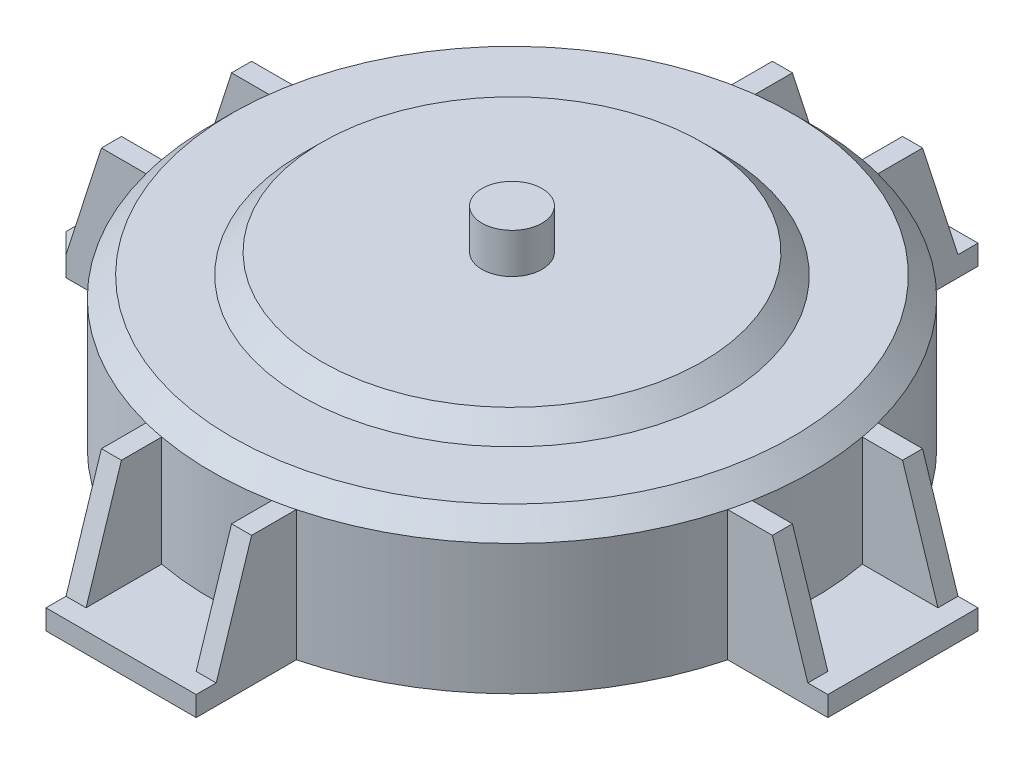
from build123d import *

# Parameters (mm, degrees)
SKETCH1_R                = 150
BOSS_EXTRUDE1_DEPTH      = 75
CHAMFER1_SIZE            = 10
BOSS_EXTRUDE2_DEPTH      = 10
CHAMFER2_SIZE            = 10
BOSS_EXTRUDE3_DEPTH      = 10
CIRPATTERN1_COUNT        = 4
CIRPATTERN1_COPY_1_DEPTH = 10
CIRPATTERN1_COPY_2_DEPTH = 10
CIRPATTERN1_COPY_3_DEPTH = 10
SKETCH8_R                = 110
BOSS_EXTRUDE5_DEPTH      = 10
CHAMFER3_SIZE            = 15
SKETCH9_R                = 15
BOSS_EXTRUDE6_DEPTH      = 20
SCALE1_SCALE             = 0.45
SKETCH10_W               = 3.419230769
SKETCH10_H               = 19.05
CUT_EXTRUDE1_DEPTH       = 2


with BuildPart() as part:
    # Sketch1 → Boss-Extrude1 (new body)
    with BuildSketch(Plane(origin=(0, 0, 0), x_dir=(1, 0, 0), z_dir=(0, 1, 0))):
        with Locations(Location((0, 0, 0), (0, 0, 270))):
            Circle(SKETCH1_R)
    extrude(amount=BOSS_EXTRUDE1_DEPTH)

    # Chamfer1
    chamfer1_edges = [part.edges().sort_by_distance(p)[0] for p in [
        (0, 75, -150),
    ]]
    chamfer(chamfer1_edges, length=CHAMFER1_SIZE)

    # Sketch4 → Boss-Extrude2 (add)
    with BuildSketch(Plane.XZ):
        with BuildLine():
            Line((-145.236875483, 37.5), (-195.236875483, 37.5))
            Line((-195.236875483, 37.5), (-195.236875483, -37.5))
            Line((-195.236875483, -37.5), (-145.236875483, -37.5))
            ThreePointArc((-145.236875483, -37.5), (-150, 0), (-145.236875483, 37.5))
        make_face()
    boss_extrude2 = extrude(amount=-BOSS_EXTRUDE2_DEPTH)

    # Chamfer2
    chamfer2_edges = [part.edges().sort_by_distance(p)[0] for p in [
        (-195.236875483, 5, -37.5),
        (-195.236875483, 5, 37.5),
    ]]
    chamfer(chamfer2_edges, length=CHAMFER2_SIZE)

    # Sketch5 → Boss-Extrude3 (add)
    with BuildSketch(Plane.XY.offset(37.5)):
        Polygon((-145.236875483, 10), (-145.236875483, 65), (-167.556875483, 65), (-185.236875483, 10), align=None)
    boss_extrude3 = extrude(amount=-BOSS_EXTRUDE3_DEPTH)

    # Mirror1: Boss-Extrude3 across plane
    add(boss_extrude3.mirror(Plane.XY))

    # CirPattern1: Boss-Extrude2, Boss-Extrude3 ×4 about axis
    cirpattern1_axis = Axis((0, 0, 0), (0, 1, 0))
    add([boss_extrude2.rotate(cirpattern1_axis, i * 360 / CIRPATTERN1_COUNT) for i in range(1, CIRPATTERN1_COUNT)])
    add([boss_extrude3.rotate(cirpattern1_axis, i * 360 / CIRPATTERN1_COUNT) for i in range(1, CIRPATTERN1_COUNT)])

    # CirPattern1 copy 1 sketch → CirPattern1 copy 1 (add)
    with BuildSketch(Plane(origin=(-37.5, 0, 0), x_dir=(0, 0, -1), z_dir=(-1, 0, 0))):
        Polygon((-145.236875483, -10), (-145.236875483, -65), (-167.556875483, -65), (-185.236875483, -10), align=None)
    extrude(amount=-CIRPATTERN1_COPY_1_DEPTH)

    # CirPattern1 copy 2 sketch → CirPattern1 copy 2 (add)
    with BuildSketch(Plane(origin=(0, 0, 37.5), x_dir=(-1, 0, 0), z_dir=(0, 0, 1))):
        Polygon((-145.236875483, -10), (-145.236875483, -65), (-167.556875483, -65), (-185.236875483, -10), align=None)
    extrude(amount=-CIRPATTERN1_COPY_2_DEPTH)

    # CirPattern1 copy 3 sketch → CirPattern1 copy 3 (add)
    with BuildSketch(Plane(origin=(37.5, 0, 0), x_dir=(0, 0, 1), z_dir=(1, 0, 0))):
        Polygon((-145.236875483, -10), (-145.236875483, -65), (-167.556875483, -65), (-185.236875483, -10), align=None)
    extrude(amount=-CIRPATTERN1_COPY_3_DEPTH)

    # Sketch8 → Boss-Extrude5 (add)
    with BuildSketch(Plane(origin=(0, 75, 0), x_dir=(1, 0, 0), z_dir=(0, 1, 0))):
        with Locations(Location((0, 0, 0), (0, 0, 270))):
            Circle(SKETCH8_R)
    extrude(amount=BOSS_EXTRUDE5_DEPTH)

    # Chamfer3
    # the kernel refuses this chamfer: 15 mm, written as the material it takes off along each edge
    with BuildSketch(Plane(origin=(0, 85, 0), x_dir=(0, 0, 1), z_dir=(-1, 0, 0))) as chamfer3_piece_1_section:
        Polygon((110, -CHAMFER3_SIZE), (110 - CHAMFER3_SIZE, 0), (110, 0), align=None)
    chamfer3_piece_1 = revolve(axis=Axis((0, 85, 0), (0, 1, 0)), mode=Mode.PRIVATE)
    chamfer3_piece_1 = split(chamfer3_piece_1, bisect_by=Plane(origin=(0, 75, -100.081022807), z_dir=(0, 1, 0)), keep=Keep.TOP, mode=Mode.PRIVATE)
    add(chamfer3_piece_1, mode=Mode.SUBTRACT)

    # Sketch9 → Boss-Extrude6 (add)
    with BuildSketch(Plane(origin=(0, 85, 0), x_dir=(1, 0, 0), z_dir=(0, 1, 0))):
        with Locations(Location((0, 0, 0), (0, 0, 270))):
            Circle(SKETCH9_R)
    extrude(amount=BOSS_EXTRUDE6_DEPTH)


with BuildPart() as part_1:
    # Scale1: scaled about (0.032774232, 38.808479164, 0)
    add(part.part.scale(SCALE1_SCALE).moved(Location((0.018025828, 21.34466354, 0))))

    # Sketch10 → Cut-Extrude1 (cut)
    with BuildSketch(Plane(origin=(0, 21.34466354, 0), x_dir=(-1, 0, 0), z_dir=(0, -1, 0))):
        with Locations((-15.883109565, 0.516821173)):
            Rectangle(SKETCH10_W, SKETCH10_H)
        with Locations((-8.556186488, 0.516821173)):
            Rectangle(SKETCH10_W, SKETCH10_H)
        Polygon((-4.404263412, 10.041821173), (5.853428896, 10.041821173), (5.853428896, 6.622590404), (2.434198127, 6.622590404), (2.434198127, -9.008178827), (-0.985032643, -9.008178827), (-0.985032643, 6.622590404), (-4.404263412, 6.622590404), align=None)
        with BuildLine():
            Line((25.998651252, 7.011833193), (23.41133154, 4.535180548))
            add(Edge.make_bspline(
                [(23.41133154, 4.535180548), (23.206488924, 4.740268602), (22.804553892, 5.142685223), (22.147239428, 5.66645811), (21.466461133, 6.111768609), (20.759978292, 6.47793405), (20.02680677, 6.761963802), (19.268393428, 6.965139371), (18.483504426, 7.085646244), (17.952169606, 7.102516796), (17.68335678, 7.111051943)],
                knots=[0, 0, 0, 0, 1.075575784, 2.110457258, 3.113929901, 4.09197124, 5.059417775, 6.02750972, 7.002078037, 8, 8, 8, 8], degree=3))
            add(Edge.make_bspline(
                [(17.68335678, 7.111051943), (17.450304279, 7.105071404), (16.992685263, 7.093328092), (16.320258194, 7.004150183), (15.677712938, 6.855182498), (15.062013849, 6.648812643), (14.47691998, 6.380260237), (13.919041191, 6.053670071), (13.391810672, 5.666543703), (12.899379983, 5.226219704), (12.451020256, 4.745474799), (12.059578539, 4.230907755), (11.726154292, 3.692109668), (11.451678135, 3.126323966), (11.242831628, 2.534419018), (11.093742551, 1.916824516), (10.999108061, 1.275335276), (10.987934554, 0.837704673), (10.98227505, 0.616039923)],
                knots=[0, 0, 0, 0, 1.075001177, 2.110859044, 3.123021556, 4.114053297, 5.101481495, 6.087880186, 7.091499647, 8.114004866, 9.131394192, 10.11971144, 11.092043119, 12.050101265, 13.015322563, 13.981809771, 14.977764287, 16, 16, 16, 16], degree=3))
            add(Edge.make_bspline(
                [(10.98227505, 0.616039923), (10.987553965, 0.386703059), (10.997954151, -0.065121959), (11.097859694, -0.728194595), (11.251781382, -1.366118253), (11.477081694, -1.974159686), (11.754358146, -2.560648213), (12.105990371, -3.114222993), (12.516028733, -3.64333772), (12.983740551, -4.138780202), (13.492490226, -4.595458936), (14.043482675, -4.989401767), (14.619953332, -5.329289395), (15.23120646, -5.59846941), (15.866632512, -5.814591472), (16.532676534, -5.966976074), (17.227838756, -6.060463498), (17.702141673, -6.071704666), (17.942851973, -6.077409596)],
                knots=[0, 0, 0, 0, 1.022067601, 2.013613092, 2.983553406, 3.943623673, 4.90013463, 5.87121881, 6.861774014, 7.881098904, 8.905697761, 9.905387765, 10.89678721, 11.884561068, 12.87834324, 13.885584958, 14.926927371, 16, 16, 16, 16], degree=3))
            add(Edge.make_bspline(
                [(17.942851973, -6.077409596), (18.099425109, -6.075996864), (18.406813013, -6.073223356), (18.857698685, -6.028201523), (19.289538861, -5.963837579), (19.704005939, -5.878627361), (20.096914912, -5.758039611), (20.473705875, -5.617027087), (20.832171165, -5.450604192), (21.17036722, -5.253029026), (21.493327379, -5.031571416), (21.798028671, -4.778176817), (22.089815916, -4.498558344), (22.365279618, -4.189300063), (22.619757472, -3.847636837), (22.861402304, -3.479847187), (23.087447323, -3.082281022), (23.22101136, -2.801539935), (23.289216155, -2.658178827)],
                knots=[0, 0, 0, 0, 1.109579412, 2.178351274, 3.208885622, 4.204702371, 5.174744997, 6.119429583, 7.05542196, 7.97267548, 8.893247984, 9.828544973, 10.778894627, 11.756245826, 12.760884819, 13.796418446, 14.874735809, 16, 16, 16, 16], degree=3))
            Line((23.289216155, -2.658178827), (17.820736588, -2.658178827))
            Line((17.820736588, -2.658178827), (17.820736588, 0.761051943))
            Line((17.820736588, 0.761051943), (27.319023848, 0.761051943))
            Line((27.319023848, 0.761051943), (27.345736588, -0.051778586))
            add(Edge.make_bspline(
                [(27.345736588, -0.051778586), (27.3423042, -0.26053409), (27.335445549, -0.677672555), (27.272764669, -1.298720666), (27.168934747, -1.911531863), (27.026989305, -2.515490652), (26.849095759, -3.113559668), (26.622225802, -3.700011902), (26.356562467, -4.278824479), (26.058905549, -4.847537891), (25.724424816, -5.393233874), (25.364307194, -5.909935933), (24.983686404, -6.396749769), (24.574284104, -6.846892846), (24.142475358, -7.264146564), (23.687410148, -7.646905698), (23.207478931, -7.99549411), (22.705224094, -8.312856576), (22.177784813, -8.591006052), (21.628060947, -8.832959196), (21.056882504, -9.038444892), (20.462774835, -9.206898462), (19.846906997, -9.336873792), (19.209265796, -9.425998048), (18.549501032, -9.48655898), (18.101996548, -9.493239277), (17.874162069, -9.496640365)],
                knots=[0, 0, 0, 0, 1.006889344, 2.011981806, 3.007738725, 4.003571281, 5.003404394, 6.015442001, 7.03424805, 8.074616296, 9.110249922, 10.119753985, 11.111721717, 12.089233633, 13.052717867, 14.006597561, 14.955430184, 15.912305663, 16.870361111, 17.829300583, 18.807640451, 19.796414044, 20.806216501, 21.841577364, 22.90109906, 24, 24, 24, 24], degree=3))
            add(Edge.make_bspline(
                [(17.874162069, -9.496640365), (17.631078126, -9.493281728), (17.149213249, -9.486623907), (16.436711447, -9.424268882), (15.744879765, -9.321355938), (15.073545645, -9.178927941), (14.421150384, -9.001664921), (13.788814898, -8.779157899), (13.177832484, -8.514478762), (12.586373536, -8.214636312), (12.021997542, -7.874588857), (11.485969362, -7.500299166), (10.981214738, -7.089359609), (10.502563419, -6.648649398), (10.061198548, -6.167335838), (9.640672183, -5.661020635), (9.261357387, -5.111134168), (8.906944748, -4.535503916), (8.592081728, -3.9343711), (8.31672949, -3.31885398), (8.081909259, -2.692516405), (7.89674783, -2.052441936), (7.746414091, -1.403093709), (7.638847479, -0.741647857), (7.578099588, -0.068187181), (7.568084995, 0.384413279), (7.56304428, 0.612223818)],
                knots=[0, 0, 0, 0, 1.084149091, 2.14910686, 3.187506334, 4.202448172, 5.208724393, 6.201130722, 7.189831603, 8.176984443, 9.156919086, 10.126598231, 11.090766514, 12.05840148, 13.026036446, 14.001772938, 14.991905635, 16.003017641, 17.015720547, 18.016462227, 19.009322657, 19.99686681, 20.986544154, 21.980959929, 22.983742515, 24, 24, 24, 24], degree=3))
            add(Edge.make_bspline(
                [(7.56304428, 0.612223818), (7.569794874, 0.923006074), (7.583125294, 1.536708889), (7.706585215, 2.440697029), (7.899040838, 3.315215356), (8.175234035, 4.157078932), (8.529655127, 4.967447434), (8.957283418, 5.748223241), (9.467407925, 6.498576457), (9.862279329, 6.963149312), (10.062593559, 7.198822375)],
                knots=[0, 0, 0, 0, 1.034044851, 2.041932006, 3.031217818, 4.011390712, 4.986069675, 5.97149666, 6.970960976, 8, 8, 8, 8], degree=3))
            add(Edge.make_bspline(
                [(10.062593559, 7.198822375), (10.186966707, 7.335166386), (10.433845536, 7.605807196), (10.828480895, 7.981868108), (11.233124316, 8.335379278), (11.653380177, 8.658844724), (12.08703927, 8.959345259), (12.535349742, 9.231247761), (12.995959859, 9.48320975), (13.472461824, 9.702365092), (13.962361083, 9.898856137), (14.467827321, 10.065115189), (14.985074702, 10.212381192), (15.518683468, 10.32441285), (16.063262896, 10.417704265), (16.622678595, 10.480233057), (17.195406123, 10.52606221), (17.582770217, 10.52886475), (17.778759425, 10.530282712)],
                knots=[0, 0, 0, 0, 1.020590567, 2.025856924, 3.013483481, 3.991664875, 4.957826714, 5.930500614, 6.890802512, 7.860442893, 8.829981142, 9.809047939, 10.802672283, 11.803273349, 12.823572789, 13.857849586, 14.916166035, 16, 16, 16, 16], degree=3))
            add(Edge.make_bspline(
                [(17.778759425, 10.530282712), (17.983631778, 10.527123228), (18.391252533, 10.520837015), (18.997317093, 10.477340522), (19.594959979, 10.410235686), (20.181662667, 10.309574601), (20.759394133, 10.185438531), (21.3251639, 10.0263895), (21.882662916, 9.845681153), (22.245592665, 9.701607108), (22.426776252, 9.62968175)],
                knots=[0, 0, 0, 0, 1.03180557, 2.052914215, 3.058998889, 4.059601663, 5.049854447, 6.033765722, 7.018406786, 8, 8, 8, 8], degree=3))
            add(Edge.make_bspline(
                [(22.426776252, 9.62968175), (22.579219827, 9.563209773), (22.889285843, 9.428007609), (23.340393679, 9.18064891), (23.792603695, 8.906423403), (24.241036316, 8.595304765), (24.685008255, 8.247874934), (25.129155051, 7.869621505), (25.568942696, 7.456133826), (25.853560056, 7.161851406), (25.998651252, 7.011833193)],
                knots=[0, 0, 0, 0, 0.894392155, 1.819168899, 2.76525314, 3.739198753, 4.75366411, 5.797420238, 6.877176959, 8, 8, 8, 8], degree=3))
        make_face()
    extrude(amount=-CUT_EXTRUDE1_DEPTH, mode=Mode.SUBTRACT)


solid = part_1.part
